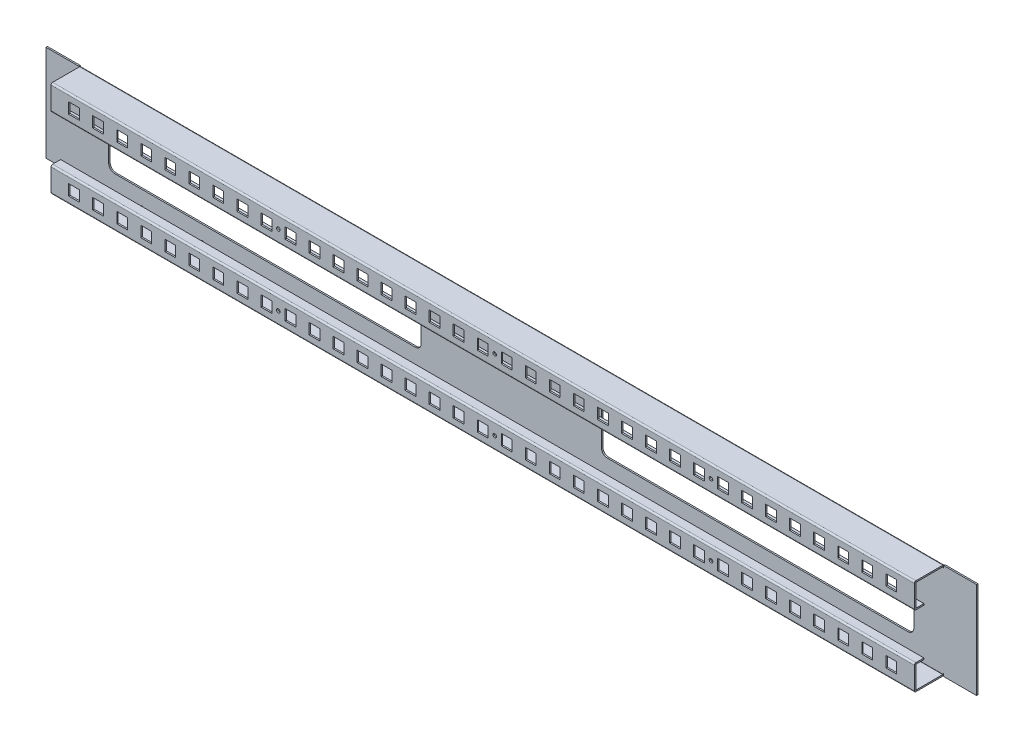
from build123d import *

# Parameters (mm, degrees)
SKETCH_1_W                          = 774.4
SKETCH_1_H                          = 80
SM_BASE_FLANGE_1_DEPTH              = 1.2
SM_EDGE_FLANGE_1_STRIP_W            = 5
SM_EDGE_FLANGE_1_STRIP_H            = 1.2
SM_EDGE_FLANGE_1_STRIP_CUT_DEPTH    = 718.4
SM_EDGE_FLANGE_1_RELIEF_W           = 5.6
SM_EDGE_FLANGE_1_RELIEF_H           = 0.6
SM_EDGE_FLANGE_1_RELIEF_CUT_DEPTH   = 1.2
SM_EDGE_FLANGE_1_STRIP_2_W          = 5
SM_EDGE_FLANGE_1_STRIP_2_H          = 1.2
SM_EDGE_FLANGE_1_STRIP_CUT_2_DEPTH  = 718.4
SM_EDGE_FLANGE_1_RELIEF_2_W         = 5.6
SM_EDGE_FLANGE_1_RELIEF_2_H         = 0.6
SM_EDGE_FLANGE_1_RELIEF_CUT_2_DEPTH = 1.2
SM_EDGE_FLANGE_1_DEPTH              = 718.4
SM_EDGE_FLANGE_1_BEND_DEPTH         = 718.4
SM_EDGE_FLANGE_2_STRIP_W            = 5
SM_EDGE_FLANGE_2_STRIP_H            = 1.2
SM_EDGE_FLANGE_2_STRIP_CUT_DEPTH    = 718.4
SM_EDGE_FLANGE_2_STRIP_2_W          = 5
SM_EDGE_FLANGE_2_STRIP_2_H          = 1.2
SM_EDGE_FLANGE_2_STRIP_CUT_2_DEPTH  = 718.4
SM_EDGE_FLANGE_2_DEPTH              = 718.4
SM_EDGE_FLANGE_2_BEND_DEPTH         = 718.4
SM_EDGE_FLANGE_3_STRIP_W            = 5
SM_EDGE_FLANGE_3_STRIP_H            = 1.2
SM_EDGE_FLANGE_3_STRIP_CUT_DEPTH    = 718.4
SM_EDGE_FLANGE_3_STRIP_2_W          = 5
SM_EDGE_FLANGE_3_STRIP_2_H          = 1.2
SM_EDGE_FLANGE_3_STRIP_CUT_2_DEPTH  = 718.4
SM_EDGE_FLANGE_3_DEPTH              = 718.4
SM_EDGE_FLANGE_3_BEND_DEPTH         = 718.4
SKETCH_25_W                         = 9
SKETCH_25_H                         = 9
CUT_EXTRUDE_1_DEPTH                 = 10
PATTERN_LINEAR_1_COUNT              = 18
PATTERN_LINEAR_1_PITCH              = 20
PATTERN_LINEAR_1_COL_COUNT          = 18
PATTERN_LINEAR_1_COL_PITCH          = 20
CUT_EXTRUDE_2_DEPTH                 = 10
SKETCH_27_R                         = 1.5
CUT_EXTRUDE_3_DEPTH                 = 10
HOLE_WIZARD_M2_1_D                  = 1.6
HOLE_WIZARD_M2_1_DEPTH              = 5.2
HOLE_WIZARD_M2_1_TIP                = 0.480688495


# Sheet-metal steps are written as plain solids
with BuildPart() as part:
    # Sketch 1 → 基体-法兰1 (new body)
    with BuildSketch(Plane.XY):
        Rectangle(SKETCH_1_W, SKETCH_1_H)
    extrude(amount=-SM_BASE_FLANGE_1_DEPTH)

    # 边线-法兰1 strip (across the edge) → 边线-法兰1 strip cut (cut)
    with BuildSketch(Plane(origin=(359.2, 40, 0), x_dir=(0, -1, 0), z_dir=(-1, 0, 0))):
        with Locations((-1.2, -0.6)):
            Rectangle(SM_EDGE_FLANGE_1_STRIP_W, SM_EDGE_FLANGE_1_STRIP_H)
    extrude(amount=SM_EDGE_FLANGE_1_STRIP_CUT_DEPTH, mode=Mode.SUBTRACT)

    # 边线-法兰1 relief (on the sheet) → 边线-法兰1 relief cut (cut)
    with BuildSketch(Plane(origin=(359.2, 38.7, 0), x_dir=(0, -1, 0), z_dir=(0, 0, 1))):
        with Locations((-2.2, 0.3)):
            Rectangle(SM_EDGE_FLANGE_1_RELIEF_W, SM_EDGE_FLANGE_1_RELIEF_H)
        with Locations((-2.2, -718.7)):
            Rectangle(SM_EDGE_FLANGE_1_RELIEF_W, SM_EDGE_FLANGE_1_RELIEF_H)
    extrude(amount=-SM_EDGE_FLANGE_1_RELIEF_CUT_DEPTH, mode=Mode.SUBTRACT)

    # 边线-法兰1 strip 2 (across the edge) → 边线-法兰1 strip cut 2 (cut)
    with BuildSketch(Plane(origin=(-359.2, -40, 0), x_dir=(0, 1, 0), z_dir=(1, 0, 0))):
        with Locations((-1.2, -0.6)):
            Rectangle(SM_EDGE_FLANGE_1_STRIP_2_W, SM_EDGE_FLANGE_1_STRIP_2_H)
    extrude(amount=SM_EDGE_FLANGE_1_STRIP_CUT_2_DEPTH, mode=Mode.SUBTRACT)

    # 边线-法兰1 relief 2 (on the sheet) → 边线-法兰1 relief cut 2 (cut)
    with BuildSketch(Plane(origin=(-359.2, -38.7, 0), x_dir=(0, 1, 0), z_dir=(0, 0, 1))):
        with Locations((-2.2, 0.3)):
            Rectangle(SM_EDGE_FLANGE_1_RELIEF_2_W, SM_EDGE_FLANGE_1_RELIEF_2_H)
        with Locations((-2.2, -718.7)):
            Rectangle(SM_EDGE_FLANGE_1_RELIEF_2_W, SM_EDGE_FLANGE_1_RELIEF_2_H)
    extrude(amount=-SM_EDGE_FLANGE_1_RELIEF_CUT_2_DEPTH, mode=Mode.SUBTRACT)

    # 边线-法兰1 section (across the edge) → 边线-法兰1 (add)
    with BuildSketch(Plane(origin=(359.2, 40, 0), x_dir=(0, -1, 0), z_dir=(-1, 0, 0))):
        with BuildLine():
            Line((0, 0.1), (0, 23.8))
            Line((0, 23.8), (1.2, 23.8))
            Line((1.2, 23.8), (1.2, 0.1))
            ThreePointArc((1.2, 0.1), (1.229289322, 0.029289322), (1.3, 0))
            Line((1.3, 0), (1.3, -1.2))
            ThreePointArc((1.3, -1.2), (0.380761184, -0.819238816), (0, 0.1))
        make_face()
    extrude(amount=SM_EDGE_FLANGE_1_DEPTH)

    # 边线-法兰1 section 2 (across the edge) → 边线-法兰1 bend (add)
    with BuildSketch(Plane(origin=(-359.2, -40, 0), x_dir=(0, 1, 0), z_dir=(1, 0, 0))):
        with BuildLine():
            Line((0, 0.1), (0, 23.8))
            Line((0, 23.8), (1.2, 23.8))
            Line((1.2, 23.8), (1.2, 0.1))
            ThreePointArc((1.2, 0.1), (1.229289322, 0.029289322), (1.3, 0))
            Line((1.3, 0), (1.3, -1.2))
            ThreePointArc((1.3, -1.2), (0.380761184, -0.819238816), (0, 0.1))
        make_face()
    extrude(amount=SM_EDGE_FLANGE_1_BEND_DEPTH)

    # 边线-法兰2 strip (across the edge) → 边线-法兰2 strip cut (cut)
    with BuildSketch(Plane(origin=(359.2, 38.8, 23.8), x_dir=(0, 0, -1), z_dir=(-1, 0, 0))):
        with Locations((-1.2, -0.6)):
            Rectangle(SM_EDGE_FLANGE_2_STRIP_W, SM_EDGE_FLANGE_2_STRIP_H)
    extrude(amount=SM_EDGE_FLANGE_2_STRIP_CUT_DEPTH, mode=Mode.SUBTRACT)

    # 边线-法兰2 strip 2 (across the edge) → 边线-法兰2 strip cut 2 (cut)
    with BuildSketch(Plane(origin=(-359.2, -38.8, 23.8), x_dir=(0, 0, -1), z_dir=(1, 0, 0))):
        with Locations((-1.2, -0.6)):
            Rectangle(SM_EDGE_FLANGE_2_STRIP_2_W, SM_EDGE_FLANGE_2_STRIP_2_H)
    extrude(amount=SM_EDGE_FLANGE_2_STRIP_CUT_2_DEPTH, mode=Mode.SUBTRACT)

    # 边线-法兰2 section (across the edge) → 边线-法兰2 (add)
    with BuildSketch(Plane(origin=(359.2, 38.8, 23.8), x_dir=(0, 0, -1), z_dir=(-1, 0, 0))):
        with BuildLine():
            Line((0, 0.1), (0, 19.8))
            Line((0, 19.8), (1.2, 19.8))
            Line((1.2, 19.8), (1.2, 0.1))
            ThreePointArc((1.2, 0.1), (1.229289322, 0.029289322), (1.3, 0))
            Line((1.3, 0), (1.3, -1.2))
            ThreePointArc((1.3, -1.2), (0.380761184, -0.819238816), (0, 0.1))
        make_face()
    extrude(amount=SM_EDGE_FLANGE_2_DEPTH)

    # 边线-法兰2 section 2 (across the edge) → 边线-法兰2 bend (add)
    with BuildSketch(Plane(origin=(-359.2, -38.8, 23.8), x_dir=(0, 0, -1), z_dir=(1, 0, 0))):
        with BuildLine():
            Line((0, 0.1), (0, 19.8))
            Line((0, 19.8), (1.2, 19.8))
            Line((1.2, 19.8), (1.2, 0.1))
            ThreePointArc((1.2, 0.1), (1.229289322, 0.029289322), (1.3, 0))
            Line((1.3, 0), (1.3, -1.2))
            ThreePointArc((1.3, -1.2), (0.380761184, -0.819238816), (0, 0.1))
        make_face()
    extrude(amount=SM_EDGE_FLANGE_2_BEND_DEPTH)

    # 边线-法兰3 strip (across the edge) → 边线-法兰3 strip cut (cut)
    with BuildSketch(Plane(origin=(359.2, 19, 22.6), x_dir=(0, 1, 0), z_dir=(-1, 0, 0))):
        with Locations((-1.2, -0.6)):
            Rectangle(SM_EDGE_FLANGE_3_STRIP_W, SM_EDGE_FLANGE_3_STRIP_H)
    extrude(amount=SM_EDGE_FLANGE_3_STRIP_CUT_DEPTH, mode=Mode.SUBTRACT)

    # 边线-法兰3 strip 2 (across the edge) → 边线-法兰3 strip cut 2 (cut)
    with BuildSketch(Plane(origin=(-359.2, -19, 22.6), x_dir=(0, -1, 0), z_dir=(1, 0, 0))):
        with Locations((-1.2, -0.6)):
            Rectangle(SM_EDGE_FLANGE_3_STRIP_2_W, SM_EDGE_FLANGE_3_STRIP_2_H)
    extrude(amount=SM_EDGE_FLANGE_3_STRIP_CUT_2_DEPTH, mode=Mode.SUBTRACT)

    # 边线-法兰3 section (across the edge) → 边线-法兰3 (add)
    with BuildSketch(Plane(origin=(359.2, 19, 22.6), x_dir=(0, 1, 0), z_dir=(-1, 0, 0))):
        with BuildLine():
            Line((0, 0.1), (0, 6.8))
            Line((0, 6.8), (1.2, 6.8))
            Line((1.2, 6.8), (1.2, 0.1))
            ThreePointArc((1.2, 0.1), (1.229289322, 0.029289322), (1.3, 0))
            Line((1.3, 0), (1.3, -1.2))
            ThreePointArc((1.3, -1.2), (0.380761184, -0.819238816), (0, 0.1))
        make_face()
    extrude(amount=SM_EDGE_FLANGE_3_DEPTH)

    # 边线-法兰3 section 2 (across the edge) → 边线-法兰3 bend (add)
    with BuildSketch(Plane(origin=(-359.2, -19, 22.6), x_dir=(0, -1, 0), z_dir=(1, 0, 0))):
        with BuildLine():
            Line((0, 0.1), (0, 6.8))
            Line((0, 6.8), (1.2, 6.8))
            Line((1.2, 6.8), (1.2, 0.1))
            ThreePointArc((1.2, 0.1), (1.229289322, 0.029289322), (1.3, 0))
            Line((1.3, 0), (1.3, -1.2))
            ThreePointArc((1.3, -1.2), (0.380761184, -0.819238816), (0, 0.1))
        make_face()
    extrude(amount=SM_EDGE_FLANGE_3_BEND_DEPTH)

    # 草图25 → 切除-拉伸1 (cut)
    with BuildSketch(Plane.XY.offset(23.8)):
        with Locations((0, 29.5)):
            Rectangle(SKETCH_25_W, SKETCH_25_H)
        with Locations((0, -29.5)):
            Rectangle(SKETCH_25_W, SKETCH_25_H)
    cut_extrude_1 = extrude(amount=-CUT_EXTRUDE_1_DEPTH, mode=Mode.SUBTRACT)

    # 阵列(线性)1: 切除-拉伸1 ×18
    with Locations(*[(i * PATTERN_LINEAR_1_PITCH, 0, 0) for i in range(1, PATTERN_LINEAR_1_COUNT)]):
        add(cut_extrude_1, mode=Mode.SUBTRACT)

    # 阵列(线性)1 col: 切除-拉伸1 ×18
    with Locations(*[(-i * PATTERN_LINEAR_1_COL_PITCH, 0, 0) for i in range(1, PATTERN_LINEAR_1_COL_COUNT)]):
        add(cut_extrude_1, mode=Mode.SUBTRACT)

    # 草图26 → 切除-拉伸2 (cut)
    with BuildSketch(Plane(origin=(0, 0, -1.2), x_dir=(-1, 0, 0), z_dir=(0, 0, -1))):
        with BuildLine():
            Line((-330, 22.5), (-80, 22.5))
            ThreePointArc((-80, 22.5), (-76.464466094, 21.035533906), (-75, 17.5))
            Line((-75, 17.5), (-75, -17.5))
            ThreePointArc((-75, -17.5), (-76.464466094, -21.035533906), (-80, -22.5))
            Line((-80, -22.5), (-330, -22.5))
            ThreePointArc((-330, -22.5), (-333.535533906, -21.035533906), (-335, -17.5))
            Line((-335, -17.5), (-335, 17.5))
            ThreePointArc((-335, 17.5), (-333.535533906, 21.035533906), (-330, 22.5))
        make_face()
    cut_extrude_2 = extrude(amount=-CUT_EXTRUDE_2_DEPTH, mode=Mode.SUBTRACT)

    # 镜向1: 切除-拉伸2 across plane
    add(cut_extrude_2.mirror(Plane(origin=(0, 0, 0), x_dir=(0, 0, 1), z_dir=(1, 0, 0))), mode=Mode.SUBTRACT)

    # 草图27 → 切除-拉伸3 (cut)
    with BuildSketch(Plane.XY.offset(23.8)):
        with Locations((-170, -29.5)):
            Circle(SKETCH_27_R)
        with Locations((10, -29.5)):
            Circle(SKETCH_27_R)
        with Locations((190, -29.5)):
            Circle(SKETCH_27_R)
        with Locations(Location((190, 29.5, 0), (0, 0, 270))):
            Circle(SKETCH_27_R)
        with Locations(Location((10, 29.5, 0), (0, 0, 270))):
            Circle(SKETCH_27_R)
        with Locations(Location((-170, 29.5, 0), (0, 0, 270))):
            Circle(SKETCH_27_R)
    extrude(amount=-CUT_EXTRUDE_3_DEPTH, mode=Mode.SUBTRACT)

    # M2 螺纹孔1
    with Locations(Plane(origin=(0, 0, -1.2), x_dir=(-1, 0, 0), z_dir=(0, 0, -1))):
        with Locations((257.2, -35), (307.2, -35), (307.2, 35), (257.2, 35)):
            Hole(HOLE_WIZARD_M2_1_D / 2, depth=HOLE_WIZARD_M2_1_DEPTH)
            with Locations((0, 0, -(HOLE_WIZARD_M2_1_DEPTH + HOLE_WIZARD_M2_1_TIP / 2))):  # 118° drill point
                Cone(0, HOLE_WIZARD_M2_1_D / 2, HOLE_WIZARD_M2_1_TIP, mode=Mode.SUBTRACT)


solid = part.part
